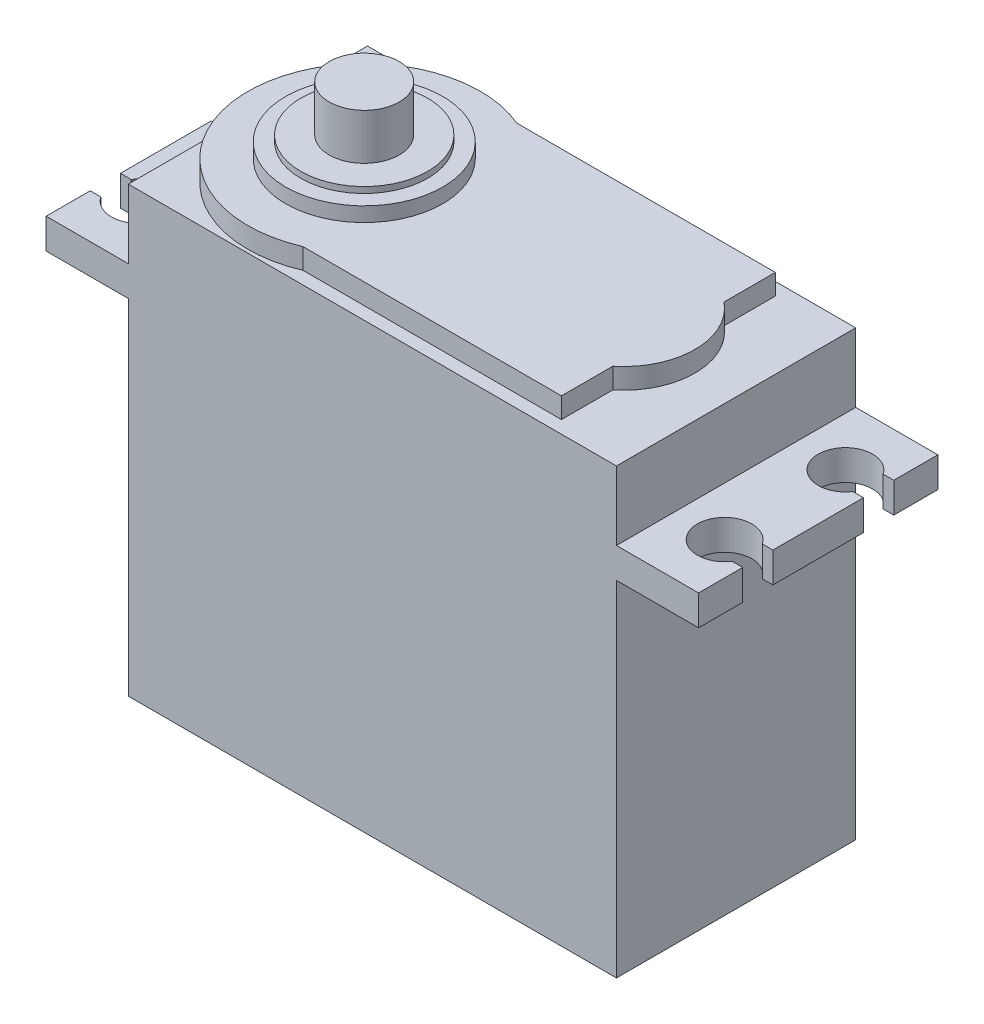
from build123d import *

# Parameters (mm, degrees)
SKETCH1_W           = 40.4
SKETCH1_H           = 19.8
BOSS_EXTRUDE1_DEPTH = 36.7
BOSS_EXTRUDE2_DEPTH = 1.7
SKETCH3_R           = 6.5
BOSS_EXTRUDE3_DEPTH = 1.2
SKETCH4_R           = 5.25
BOSS_EXTRUDE4_DEPTH = 0.5
SKETCH5_R           = 2.9
BOSS_EXTRUDE5_DEPTH = 3.8
SKETCH6_W           = 19.8
SKETCH6_H           = 2.5
BOSS_EXTRUDE6_DEPTH = 6.8
CUT_EXTRUDE1_DEPTH  = 6.8
SKETCH8_W           = 7.5
SKETCH8_H           = 5
BOSS_EXTRUDE7_DEPTH = 6


with BuildPart() as part:
    # Sketch1 → Boss-Extrude1 (new body)
    with BuildSketch(Plane(origin=(0, 0, 0), x_dir=(1, 0, 0), z_dir=(0, 1, 0))):
        Rectangle(SKETCH1_W, SKETCH1_H)
    extrude(amount=BOSS_EXTRUDE1_DEPTH)

    # Sketch2 → Boss-Extrude2 (add)
    with BuildSketch(Plane(origin=(0, 36.7, 0), x_dir=(1, 0, 0), z_dir=(0, 1, 0))):
        with BuildLine():
            Line((14.6, 8.85), (-6.791070164, 8.85))
            ThreePointArc((-6.791070164, 8.85), (-20.2, 0), (-6.791070164, -8.85))
            Line((-6.791070164, -8.85), (14.6, -8.85))
            Line((14.6, -8.85), (14.6, -4.6))
            ThreePointArc((14.6, -4.6), (16.8, 0), (14.6, 4.6))
            Line((14.6, 4.6), (14.6, 8.85))
        make_face()
    extrude(amount=BOSS_EXTRUDE2_DEPTH)

    # Sketch3 → Boss-Extrude3 (add)
    with BuildSketch(Plane(origin=(0, 38.4, 0), x_dir=(1, 0, 0), z_dir=(0, 1, 0))):
        with Locations((-10.575, 0)):
            Circle(SKETCH3_R)
    extrude(amount=BOSS_EXTRUDE3_DEPTH)

    # Sketch4 → Boss-Extrude4 (add)
    with BuildSketch(Plane(origin=(0, 39.6, 0), x_dir=(1, 0, 0), z_dir=(0, 1, 0))):
        with Locations((-10.575, 0)):
            Circle(SKETCH4_R)
    extrude(amount=BOSS_EXTRUDE4_DEPTH)

    # Sketch5 → Boss-Extrude5 (add)
    with BuildSketch(Plane(origin=(0, 40.1, 0), x_dir=(1, 0, 0), z_dir=(0, 1, 0))):
        with Locations((-10.575, 0)):
            Circle(SKETCH5_R)
    extrude(amount=BOSS_EXTRUDE5_DEPTH)

    # Sketch6 → Boss-Extrude6 (add)
    with BuildSketch(Plane.ZY.offset(20.2)):
        with Locations((0, 29.75)):
            Rectangle(SKETCH6_W, SKETCH6_H)
    boss_extrude6 = extrude(amount=BOSS_EXTRUDE6_DEPTH)

    # Sketch7 → Cut-Extrude1 (cut)
    with BuildSketch(Plane(origin=(0, 31, 0), x_dir=(1, 0, 0), z_dir=(0, 1, 0))):
        with BuildLine():
            Line((-27, 6.25), (-27, 3.75))
            Line((-27, 3.75), (-26.120828693, 3.75))
            ThreePointArc((-26.120828693, 3.75), (-22, 5), (-26.120828693, 6.25))
            Line((-26.120828693, 6.25), (-27, 6.25))
        make_face()
        with BuildLine():
            Line((-27, -3.75), (-27, -6.25))
            Line((-27, -6.25), (-26.120828693, -6.25))
            ThreePointArc((-26.120828693, -6.25), (-22, -5), (-26.120828693, -3.75))
            Line((-26.120828693, -3.75), (-27, -3.75))
        make_face()
    cut_extrude1 = extrude(amount=-CUT_EXTRUDE1_DEPTH, mode=Mode.SUBTRACT)

    # Mirror1: Boss-Extrude6, Cut-Extrude1 across plane
    add(boss_extrude6.mirror(Plane(origin=(0, 0, 0), x_dir=(0, 0, 1), z_dir=(1, 0, 0))))
    add(cut_extrude1.mirror(Plane(origin=(0, 0, 0), x_dir=(0, 0, 1), z_dir=(1, 0, 0))), mode=Mode.SUBTRACT)

    # Sketch8 → Boss-Extrude7 (add)
    with BuildSketch(Plane.ZY.offset(20.2)):
        with Locations((0, 6.2)):
            Rectangle(SKETCH8_W, SKETCH8_H)
    extrude(amount=BOSS_EXTRUDE7_DEPTH)


solid = part.part
